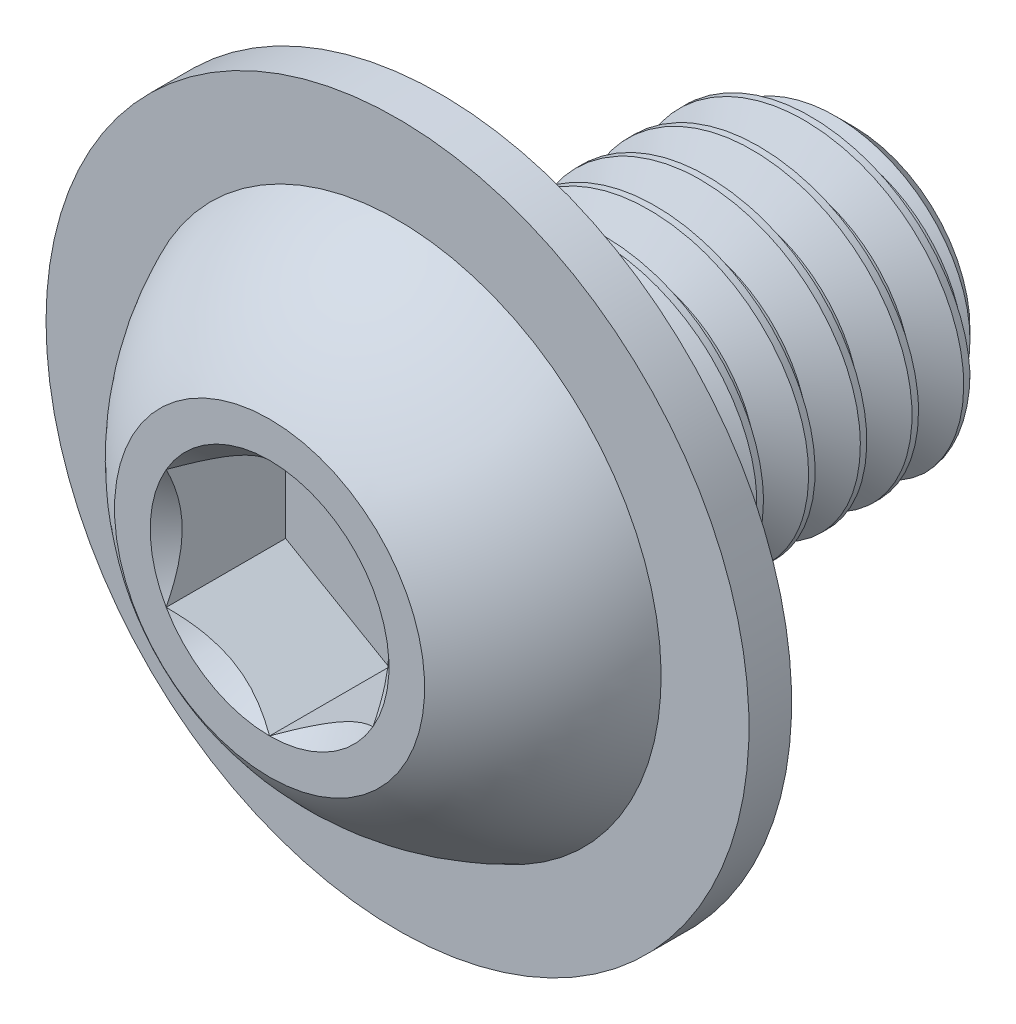
from build123d import *

# Parameters (mm, degrees)
SKETCH1_W           = 8
SKETCH1_H           = 3
CHAMFER1_SIZE       = 0.75
CUT_SWEEP1_PITCH    = 1
SKETCH11_R          = 6.8
BOSS_EXTRUDE3_DEPTH = 0.825
CUT_EXTRUDE2_DEPTH  = 2.31


with BuildPart() as part:
    # Sketch1 → Revolve1 (revolve)
    with BuildSketch(Plane(origin=(0, 0, 0), x_dir=(0, 0, -1), z_dir=(1, 0, 0))):
        with Locations((7.3, 1.5)):
            Rectangle(SKETCH1_W, SKETCH1_H)
    revolve(axis=Axis((0, 0, -11.3), (0, 0, 1)))

    # Chamfer1
    chamfer1_edges = [part.edges().sort_by_distance(p)[0] for p in [
        (0, -3, -11.3),
    ]]
    chamfer(chamfer1_edges, length=CHAMFER1_SIZE)

    # Cut-Sweep1: arcs per turn and ends read off the stored shape
    # Cut-Sweep1: the profile of Sketch2 profile screwed along a right-hand helix through 9 turns, 8 arcs to a turn; built about Z, then put on its axis
    cut_sweep1_z = Axis((0, 0, 0), (0, 0, 1))
    cut_sweep1_corners = [(3.0003, 0, 0.000173205), (3.0003, 0, -0.875173205), (2.350480947, 0, -0.5), (2.350480947, 0, -0.375)]
    with BuildLine(mode=Mode.PRIVATE) as cut_sweep1_profile:
        Line(cut_sweep1_corners[0], cut_sweep1_corners[1])
        Line(cut_sweep1_corners[1], cut_sweep1_corners[2])
        Line(cut_sweep1_corners[2], cut_sweep1_corners[3])
        Line(cut_sweep1_corners[3], cut_sweep1_corners[0])
    cut_sweep1_cap = Face(cut_sweep1_profile.wire())
    cut_sweep1_turn_angles = [0, 22.5, 45, 67.5, 90, 112.5, 135, 157.5, 180, 202.5, 225, 247.5, 270, 292.5, 315, 337.5, 360]
    cut_sweep1_turn_weights = [1, 0.9238795325112867, 1, 0.9238795325112867, 1, 0.9238795325112867, 1, 0.9238795325112867, 1, 0.9238795325112867, 1, 0.9238795325112867, 1, 0.9238795325112867, 1, 0.9238795325112867, 1]
    cut_sweep1_turn_rails = [Edge.make_bspline([Vector(p[0], p[1], 0).rotate(cut_sweep1_z, cut_sweep1_turn_angles[k]) / cut_sweep1_turn_weights[k] + Vector(0, 0, p[2] + CUT_SWEEP1_PITCH * cut_sweep1_turn_angles[k] / 360) for k in range(17)], [0, 0, 0, 1, 1, 2, 2, 3, 3, 4, 4, 5, 5, 6, 6, 7, 7, 8, 8, 8], 2, cut_sweep1_turn_weights) for p in cut_sweep1_corners]
    cut_sweep1_turn_sides = [Face.make_surface_from_curves(cut_sweep1_turn_rails[p[0]], cut_sweep1_turn_rails[p[1]]) for p in [(0, 1), (1, 2), (2, 3), (3, 0)]]
    cut_sweep1 = Plane(origin=(0, 0, -11.3), x_dir=(0, 1, 0), z_dir=(0, 0, 1)) * Solid(Shell([*[p.moved(Location((0, 0, CUT_SWEEP1_PITCH * i))) for i in range(9) for p in cut_sweep1_turn_sides], cut_sweep1_cap, cut_sweep1_cap.rotate(cut_sweep1_z, 3240).moved(Location((0, 0, CUT_SWEEP1_PITCH * 3240 / 360)))]))
    add(cut_sweep1, mode=Mode.SUBTRACT)

    # Sketch7 → Revolve2 (revolve)
    with BuildSketch(Plane(origin=(0, 0, 0), x_dir=(0, 0, -1), z_dir=(1, 0, 0)), mode=Mode.PRIVATE) as revolve2_sk:
        with BuildLine():
            Line((2.475, 5.1), (3.3, 5.1))
            Line((3.3, 5.1), (3.3, 0))
            Line((3.3, 0), (0, 0))
            Line((0, 0), (0, 3))
            ThreePointArc((0, 3), (1.080662412, 4.234844301), (2.475, 5.1))
        make_face()
    revolve(revolve2_sk.sketch.rotate(Axis((0, 0, 0), (0, 0, -1)), 189.052465708), axis=Axis((0, 0, 0), (0, 0, -1)))

    # Sketch11 → Boss-Extrude3 (add)
    with BuildSketch(Plane(origin=(0, 0, -3.3), x_dir=(-1, 0, 0), z_dir=(0, 0, -1))):
        Circle(SKETCH11_R)
    extrude(amount=-BOSS_EXTRUDE3_DEPTH)

    # Sketch5 → Cut-Extrude2 (cut)
    with BuildSketch(Plane.XY):
        Polygon((2, -1.154700538), (2, 1.154700538), (0, 2.309401077), (-2, 1.154700538), (-2, -1.154700538), (0, -2.309401077), align=None)
    extrude(amount=-CUT_EXTRUDE2_DEPTH, mode=Mode.SUBTRACT)

    # Cut-Extrude3 cone 1 section (through the dimple's axis) → Cut-Extrude3 (revolve, cut)
    with BuildSketch(Plane(origin=(0, 0, 0), x_dir=(0, -1, 0), z_dir=(1, 0, 0))):
        Polygon((0, 0), (2.309401077, 0), (0, 2.309401077), align=None)
    revolve(axis=Axis((0, 0, 0), (0, 0, -1)), mode=Mode.SUBTRACT)


solid = part.part
